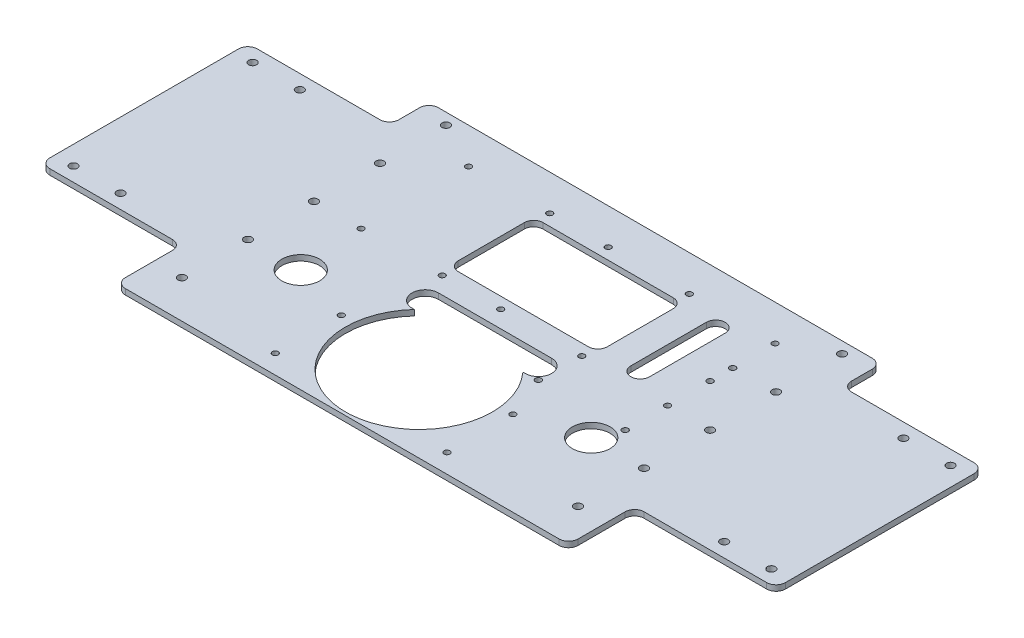
from build123d import *

# Parameters (mm, degrees)
SKETCH_1_W          = 240
SKETCH_1_H          = 166
EXTRUDE_1266_DEPTH  = 3
SKETCH_4_R          = 2.1
SKETCH_4_R_2        = 1.55
CUT_EXTRUDE_3_DEPTH = 251.068459046
SKETCH_5_R          = 1.55
SKETCH_5_R_2        = 10
SKETCH_5_W          = 79
SKETCH_5_H          = 45
CUT_EXTRUDE_4_DEPTH = 251.068459046
SKETCH_6_W          = 75
SKETCH_6_H          = 110
SKETCH_6_R          = 2.1
EXTRUDE_1_DEPTH     = 3
FILLET_1_R          = 5
SKETCH_8_R          = 39
CUT_EXTRUDE_6_DEPTH = 10
CUT_EXTRUDE_START   = -10
SKETCH_9_R          = 1.55
SKETCH_9_R_2        = 1.6
CUT_EXTRUDE_7_DEPTH = 10


with BuildPart() as part:
    # 草图1 → Extrude 1266 (new body)
    with BuildSketch(Plane(origin=(0, 0, 0), x_dir=(1, 0, 0), z_dir=(0, 1, 0))):
        with Locations((31.575924772, -115.871750732)):
            Rectangle(SKETCH_1_W, SKETCH_1_H)
    extrude(amount=EXTRUDE_1266_DEPTH)

    # 草图4 → 切除-拉伸3 (cut, through all)
    with BuildSketch(Plane(origin=(0, 3, 0), x_dir=(1, 0, 0), z_dir=(0, 1, 0))):
        with Locations((-73.424075228, -73.871750732)):
            Circle(SKETCH_4_R)
        with Locations((136.575924772, -178.871750732)):
            Circle(SKETCH_4_R)
        with Locations((-73.424075228, -108.871750732)):
            Circle(SKETCH_4_R)
        with Locations((-73.424075228, -143.871750732)):
            Circle(SKETCH_4_R)
        with Locations((-73.424075228, -178.871750732)):
            Circle(SKETCH_4_R)
        with Locations((136.575924772, -143.871750732)):
            Circle(SKETCH_4_R)
        with Locations((136.575924772, -108.871750732)):
            Circle(SKETCH_4_R)
        with Locations((136.575924772, -73.871750732)):
            Circle(SKETCH_4_R)
        with Locations((-73.424075228, -38.871750732)):
            Circle(SKETCH_4_R)
        with Locations((136.575924772, -38.871750732)):
            Circle(SKETCH_4_R)
        with Locations((77.075924772, -188.871750732)):
            Circle(SKETCH_4_R_2)
        with Locations((-13.924075228, -188.871750732)):
            Circle(SKETCH_4_R_2)
        with Locations((77.075924772, -153.871750732)):
            Circle(SKETCH_4_R_2)
        with Locations((-13.924075228, -153.871750732)):
            Circle(SKETCH_4_R_2)
    extrude(amount=-CUT_EXTRUDE_3_DEPTH, mode=Mode.SUBTRACT)

    # 草图5 → 切除-拉伸4 (cut, through all)
    with BuildSketch(Plane(origin=(0, 3, 0), x_dir=(1, 0, 0), z_dir=(0, 1, 0))):
        with Locations((-5.424075228, -51.871750732)):
            Circle(SKETCH_5_R)
        with Locations((68.575924772, -51.871750732)):
            Circle(SKETCH_5_R)
        with Locations((68.575924772, -108.871750732)):
            Circle(SKETCH_5_R)
        with Locations((-5.424075228, -108.871750732)):
            Circle(SKETCH_5_R)
        with Locations((-45.424075228, -143.871750732)):
            Circle(SKETCH_5_R_2)
        with Locations((108.575924772, -143.871750732)):
            Circle(SKETCH_5_R_2)
        with Locations((31.575924772, -80.371750732)):
            Rectangle(SKETCH_5_W, SKETCH_5_H)
        with BuildLine():
            Line((86.075924772, -100.371750732), (86.075924772, -60.371750732))
            ThreePointArc((86.075924772, -60.371750732), (91.075924772, -55.371750732), (96.075924772, -60.371750732))
            Line((96.075924772, -60.371750732), (96.075924772, -100.371750732))
            ThreePointArc((96.075924772, -100.371750732), (91.075924772, -105.371750732), (86.075924772, -100.371750732))
        make_face()
        with BuildLine():
            Line((1.575924772, -117.871750732), (61.575924772, -117.871750732))
            ThreePointArc((61.575924772, -117.871750732), (68.575924772, -124.871750732), (61.575924772, -131.871750732))
            Line((61.575924772, -131.871750732), (41.575924772, -131.871750732))
            ThreePointArc((41.575924772, -131.871750732), (31.575924772, -141.871750732), (21.575924772, -131.871750732))
            Line((21.575924772, -131.871750732), (1.575924772, -131.871750732))
            ThreePointArc((1.575924772, -131.871750732), (-5.424075228, -124.871750732), (1.575924772, -117.871750732))
        make_face()
    extrude(amount=-CUT_EXTRUDE_4_DEPTH, mode=Mode.SUBTRACT)

    # 草图6 → 凸台-拉伸1 (add)
    # profile 1 of 2: a face of its own
    with BuildSketch(Plane(origin=(0, 0, 0), x_dir=(1, 0, 0), z_dir=(0, 1, 0))):
        with Locations((-125.924075228, -108.871750732)):
            Rectangle(SKETCH_6_W, SKETCH_6_H)
        with Locations((-153.424075228, -61.371750732)):
            Circle(SKETCH_6_R, mode=Mode.SUBTRACT)
        with Locations((-153.424075228, -156.371750732)):
            Circle(SKETCH_6_R, mode=Mode.SUBTRACT)
        with Locations((-128.424075228, -61.371750732)):
            Circle(SKETCH_6_R, mode=Mode.SUBTRACT)
        with Locations((-128.424075228, -156.371750732)):
            Circle(SKETCH_6_R, mode=Mode.SUBTRACT)
    # profile 2 of 2: a face of its own
    with BuildSketch(Plane(origin=(0, 0, 0), x_dir=(1, 0, 0), z_dir=(0, 1, 0))):
        with Locations((189.075924772, -108.871750732)):
            Rectangle(SKETCH_6_W, SKETCH_6_H)
        with Locations((216.575924772, -156.371750732)):
            Circle(SKETCH_6_R, mode=Mode.SUBTRACT)
        with Locations((216.575924772, -61.371750732)):
            Circle(SKETCH_6_R, mode=Mode.SUBTRACT)
        with Locations((191.575924772, -156.371750732)):
            Circle(SKETCH_6_R, mode=Mode.SUBTRACT)
        with Locations((191.575924772, -61.371750732)):
            Circle(SKETCH_6_R, mode=Mode.SUBTRACT)
    extrude(amount=EXTRUDE_1_DEPTH)

    # 圆角1
    fillet_1_edges = [part.edges().sort_by_distance(p)[0] for p in [
        (71.075924772, 1.5, 102.871750732),
        (-7.924075228, 1.5, 102.871750732),
        (-7.924075228, 1.5, 57.871750732),
        (71.075924772, 1.5, 57.871750732),
        (151.575924772, 1.5, 32.871750732),
        (-88.424075228, 1.5, 32.871750732),
        (151.575924772, 1.5, 53.871750732),
        (151.575924772, 1.5, 163.871750732),
        (-88.424075228, 1.5, 163.871750732),
        (-88.424075228, 1.5, 53.871750732),
        (226.575924772, 1.5, 53.871750732),
        (226.575924772, 1.5, 163.871750732),
        (151.575924772, 1.5, 198.871750732),
        (-88.424075228, 1.5, 198.871750732),
        (-163.424075228, 1.5, 53.871750732),
        (-163.424075228, 1.5, 163.871750732),
        (41.575924772, 1.5, 131.871750732),
        (21.575924772, 1.5, 131.871750732),
    ]]
    fillet(fillet_1_edges, radius=FILLET_1_R)

    # 草图8 → 切除-拉伸6 (cut)
    with BuildSketch(Plane(origin=(0, 3, 0), x_dir=(1, 0, 0), z_dir=(0, 1, 0))):
        with Locations((31.575924772, -158.205226673)):
            Circle(SKETCH_8_R)
    extrude(amount=-CUT_EXTRUDE_6_DEPTH, mode=Mode.SUBTRACT)

    # 草图9 → 切除-拉伸7 (cut)
    with BuildSketch(Plane.XZ.offset(CUT_EXTRUDE_START)):
        with Locations((68.575924772, 108.871750732)):
            Circle(SKETCH_9_R)
        with Locations((-48.424075228, 108.871750732)):
            Circle(SKETCH_9_R)
        with Locations((25.575924772, 108.871750732)):
            Circle(SKETCH_9_R)
        with Locations((25.575924772, 51.871750732)):
            Circle(SKETCH_9_R)
        with Locations((-48.424075228, 51.871750732)):
            Circle(SKETCH_9_R)
        with Locations((114.075924772, 51.871750732)):
            Circle(SKETCH_9_R)
        with Locations((114.075924772, 74.371750732)):
            Circle(SKETCH_9_R_2)
        with Locations((114.075924772, 86.371750732)):
            Circle(SKETCH_9_R_2)
        with Locations((114.075924772, 108.871750732)):
            Circle(SKETCH_9_R)
        with Locations((114.075924772, 131.371750732)):
            Circle(SKETCH_9_R_2)
        with Locations((68.075924772, 131.371750732)):
            Circle(SKETCH_9_R_2)
    extrude(amount=CUT_EXTRUDE_7_DEPTH, mode=Mode.SUBTRACT)


solid = part.part
